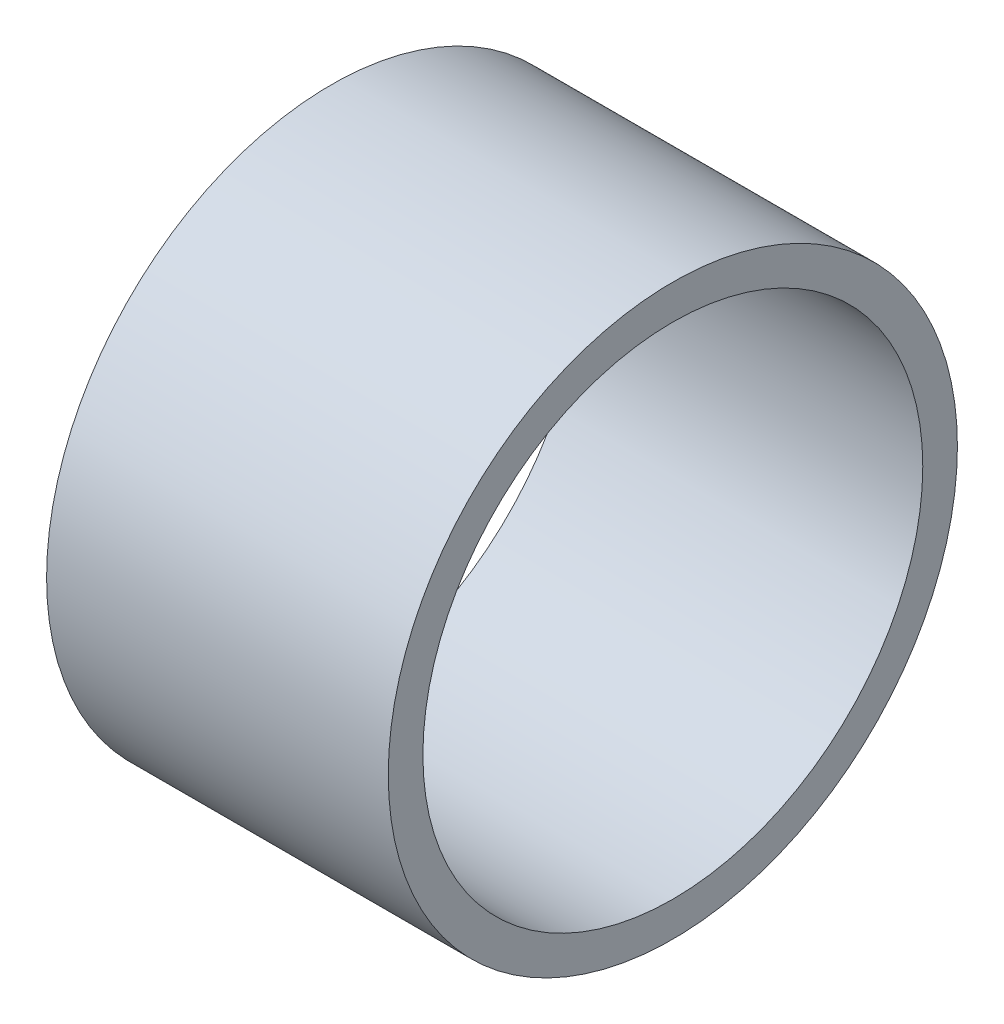
from build123d import *

# Parameters (mm, degrees)
SKETCH1_R           = 6.262000049
SKETCH1_R_2         = 5.500000049
BOSS_EXTRUDE1_DEPTH = 7.5184


with BuildPart() as part:
    # Sketch1 → Boss-Extrude1 (new body)
    with BuildSketch(Plane.YZ):
        Circle(SKETCH1_R)
        Circle(SKETCH1_R_2, mode=Mode.SUBTRACT)
    extrude(amount=BOSS_EXTRUDE1_DEPTH)


solid = part.part
